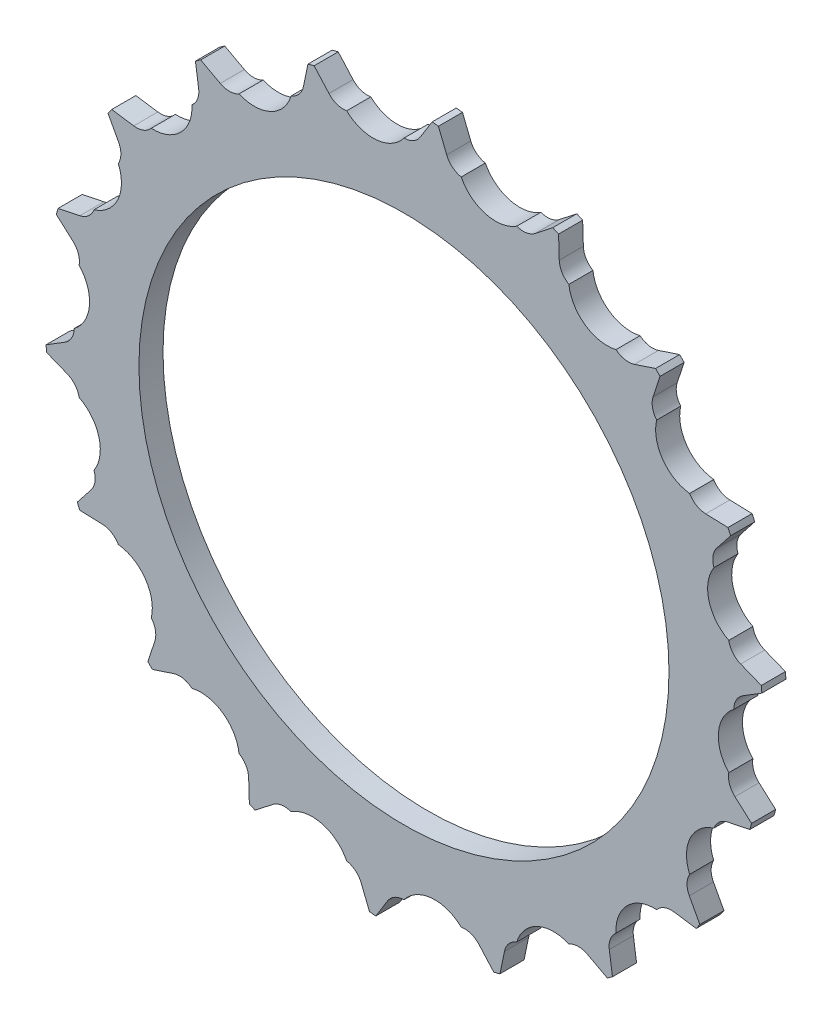
from build123d import *

# Parameters (mm, degrees)
BOSS_EXTRUDE1_DEPTH                 = 5
SKETCH2_R                           = 12.5
BOSS_EXTRUDE2_DEPTH                 = 40
CUT_EXTRUDE2_DEPTH                  = 10
SKETCH9_R                           = 100
SKETCH9_R_2                         = 74.5
CUT_EXTRUDE5_DEPTH                  = 10
FILLET1_R                           = 30
SKETCH3_R                           = 5
CUT_EXTRUDE1_DEPTH                  = 115.269213892
F_1_0MM_DOWEL_HOLE1_D               = 2.8
F_1_0MM_DOWEL_HOLE1_DEPTH           = 33.158795133
F_1_0MM_DOWEL_HOLE1_TIP             = 0.841204867
F_1_0MM_DOWEL_HOLE1_ON_FACE_2_D     = 2.8
F_1_0MM_DOWEL_HOLE1_ON_FACE_2_DEPTH = 33.158795133
F_1_0MM_DOWEL_HOLE1_ON_FACE_2_TIP   = 0.841204867
CIRPATTERN1_COUNT                   = 18
CUT_EXTRUDE3_DEPTH                  = 115.269213931
CUT_EXTRUDE3_DEPTH_BACK             = 115.269213931
SKETCH6_W                           = 154.176776301
SKETCH6_H                           = 44.757292759
CUT_EXTRUDE4_DEPTH                  = 106.288856217
CUT_EXTRUDE4_DEPTH_BACK             = 106.288856217
SKETCH10_R                          = 55
CUT_EXTRUDE6_DEPTH                  = 10


with BuildPart() as part:
    # Sketch1 → Boss-Extrude1 (new body)
    with BuildSketch(Plane.XY):
        with BuildLine():
            ThreePointArc((3.400646872, 70.34391338), (0, 68.45), (-3.400646872, 70.34391338))
            Line((-3.400646872, 70.34391338), (-6.085453124, 74.679004775))
            ThreePointArc((-6.085453124, 74.679004775), (-6.554111855, 74.913841296), (-6.974871672, 74.601190735))
            Line((-6.974871672, 74.601190735), (-8.866108963, 69.865747406))
            ThreePointArc((-8.866108963, 69.865747406), (-11.886217761, 67.410090694), (-15.564075773, 68.684715142))
            Line((-15.564075773, 68.684715142), (-18.960874506, 72.487735044))
            ThreePointArc((-18.960874506, 72.487735044), (-19.463192192, 72.637622137), (-19.823268522, 72.256657264))
            Line((-19.823268522, 72.256657264), (-20.863472565, 67.264746051))
            ThreePointArc((-20.863472565, 67.264746051), (-23.411278811, 64.321959893), (-27.254598108, 64.93856659))
            Line((-27.254598108, 64.93856659), (-31.260179312, 68.093962165))
            ThreePointArc((-31.260179312, 68.093962165), (-31.780893283, 68.154345585), (-32.069345388, 67.716641827))
            Line((-32.069345388, 67.716641827), (-32.226910109, 62.619939425))
            ThreePointArc((-32.226910109, 62.619939425), (-34.225, 59.279438889), (-38.117003271, 59.219292553))
            Line((-38.117003271, 59.219292553), (-42.609659387, 61.631188702))
            ThreePointArc((-42.609659387, 61.631188702), (-43.132948014, 61.600233731), (-43.341011423, 61.119090493))
            Line((-43.341011423, 61.119090493), (-42.611149298, 56.072457626))
            ThreePointArc((-42.611149298, 56.072457626), (-43.998811883, 52.435742131), (-47.821242577, 51.700670278))
            Line((-47.821242577, 51.700670278), (-52.664466523, 53.295782758))
            ThreePointArc((-52.664466523, 53.295782758), (-53.174429945, 53.174429945), (-53.295782758, 52.664466523))
            Line((-53.295782758, 52.664466523), (-51.700670278, 47.821242577))
            ThreePointArc((-51.700670278, 47.821242577), (-52.435742131, 43.998811883), (-56.072457626, 42.611149298))
            Line((-56.072457626, 42.611149298), (-61.119090493, 43.341011423))
            ThreePointArc((-61.119090493, 43.341011423), (-61.600233731, 43.132948014), (-61.631188702, 42.609659387))
            Line((-61.631188702, 42.609659387), (-59.219292553, 38.117003271))
            ThreePointArc((-59.219292553, 38.117003271), (-59.279438889, 34.225), (-62.619939425, 32.226910109))
            Line((-62.619939425, 32.226910109), (-67.716641827, 32.069345388))
            ThreePointArc((-67.716641827, 32.069345388), (-68.154345585, 31.780893283), (-68.093962165, 31.260179312))
            Line((-68.093962165, 31.260179312), (-64.93856659, 27.254598108))
            ThreePointArc((-64.93856659, 27.254598108), (-64.321959893, 23.411278811), (-67.264746051, 20.863472565))
            Line((-67.264746051, 20.863472565), (-72.256657264, 19.823268522))
            ThreePointArc((-72.256657264, 19.823268522), (-72.637622137, 19.463192192), (-72.487735044, 18.960874506))
            Line((-72.487735044, 18.960874506), (-68.684715142, 15.564075773))
            ThreePointArc((-68.684715142, 15.564075773), (-67.410090694, 11.886217761), (-69.865747406, 8.866108963))
            Line((-69.865747406, 8.866108963), (-74.601190735, 6.974871672))
            ThreePointArc((-74.601190735, 6.974871672), (-74.913841296, 6.554111855), (-74.679004775, 6.085453124))
            Line((-74.679004775, 6.085453124), (-70.34391338, 3.400646872))
            ThreePointArc((-70.34391338, 3.400646872), (-68.45, 0), (-70.34391338, -3.400646872))
            Line((-70.34391338, -3.400646872), (-74.679004775, -6.085453124))
            ThreePointArc((-74.679004775, -6.085453124), (-74.913841296, -6.554111855), (-74.601190735, -6.974871672))
            Line((-74.601190735, -6.974871672), (-69.865747406, -8.866108963))
            ThreePointArc((-69.865747406, -8.866108963), (-67.410090694, -11.886217761), (-68.684715142, -15.564075773))
            Line((-68.684715142, -15.564075773), (-72.487735044, -18.960874506))
            ThreePointArc((-72.487735044, -18.960874506), (-72.637622137, -19.463192192), (-72.256657264, -19.823268522))
            Line((-72.256657264, -19.823268522), (-67.264746051, -20.863472565))
            ThreePointArc((-67.264746051, -20.863472565), (-64.321959893, -23.411278811), (-64.93856659, -27.254598108))
            Line((-64.93856659, -27.254598108), (-68.093962165, -31.260179312))
            ThreePointArc((-68.093962165, -31.260179312), (-68.154345585, -31.780893283), (-67.716641827, -32.069345388))
            Line((-67.716641827, -32.069345388), (-62.619939425, -32.226910109))
            ThreePointArc((-62.619939425, -32.226910109), (-59.279438889, -34.225), (-59.219292553, -38.117003271))
            Line((-59.219292553, -38.117003271), (-61.631188702, -42.609659387))
            ThreePointArc((-61.631188702, -42.609659387), (-61.600233731, -43.132948014), (-61.119090493, -43.341011423))
            Line((-61.119090493, -43.341011423), (-56.072457626, -42.611149298))
            ThreePointArc((-56.072457626, -42.611149298), (-52.435742131, -43.998811883), (-51.700670278, -47.821242577))
            Line((-51.700670278, -47.821242577), (-53.295782758, -52.664466523))
            ThreePointArc((-53.295782758, -52.664466523), (-53.174429945, -53.174429945), (-52.664466523, -53.295782758))
            Line((-52.664466523, -53.295782758), (-47.821242577, -51.700670278))
            ThreePointArc((-47.821242577, -51.700670278), (-43.998811883, -52.435742131), (-42.611149298, -56.072457626))
            Line((-42.611149298, -56.072457626), (-43.341011423, -61.119090493))
            ThreePointArc((-43.341011423, -61.119090493), (-43.132948014, -61.600233731), (-42.609659387, -61.631188702))
            Line((-42.609659387, -61.631188702), (-38.117003271, -59.219292553))
            ThreePointArc((-38.117003271, -59.219292553), (-34.225, -59.279438889), (-32.226910109, -62.619939425))
            Line((-32.226910109, -62.619939425), (-32.069345388, -67.716641827))
            ThreePointArc((-32.069345388, -67.716641827), (-31.780893283, -68.154345585), (-31.260179312, -68.093962165))
            Line((-31.260179312, -68.093962165), (-27.254598108, -64.93856659))
            ThreePointArc((-27.254598108, -64.93856659), (-23.411278811, -64.321959893), (-20.863472565, -67.264746051))
            Line((-20.863472565, -67.264746051), (-19.823268522, -72.256657264))
            ThreePointArc((-19.823268522, -72.256657264), (-19.463192192, -72.637622137), (-18.960874506, -72.487735044))
            Line((-18.960874506, -72.487735044), (-15.564075773, -68.684715142))
            ThreePointArc((-15.564075773, -68.684715142), (-11.886217761, -67.410090694), (-8.866108963, -69.865747406))
            Line((-8.866108963, -69.865747406), (-6.974871672, -74.601190735))
            ThreePointArc((-6.974871672, -74.601190735), (-6.554111855, -74.913841296), (-6.085453124, -74.679004775))
            Line((-6.085453124, -74.679004775), (-3.400646872, -70.34391338))
            ThreePointArc((-3.400646872, -70.34391338), (0, -68.45), (3.400646872, -70.34391338))
            Line((3.400646872, -70.34391338), (6.085453124, -74.679004775))
            ThreePointArc((6.085453124, -74.679004775), (6.554111855, -74.913841296), (6.974871672, -74.601190735))
            Line((6.974871672, -74.601190735), (8.866108963, -69.865747406))
            ThreePointArc((8.866108963, -69.865747406), (11.886217761, -67.410090694), (15.564075773, -68.684715142))
            Line((15.564075773, -68.684715142), (18.960874506, -72.487735044))
            ThreePointArc((18.960874506, -72.487735044), (19.463192192, -72.637622137), (19.823268522, -72.256657264))
            Line((19.823268522, -72.256657264), (20.863472565, -67.264746051))
            ThreePointArc((20.863472565, -67.264746051), (23.411278811, -64.321959893), (27.254598108, -64.93856659))
            Line((27.254598108, -64.93856659), (31.260179312, -68.093962165))
            ThreePointArc((31.260179312, -68.093962165), (31.780893283, -68.154345585), (32.069345388, -67.716641827))
            Line((32.069345388, -67.716641827), (32.226910109, -62.619939425))
            ThreePointArc((32.226910109, -62.619939425), (34.225, -59.279438889), (38.117003271, -59.219292553))
            Line((38.117003271, -59.219292553), (42.609659387, -61.631188702))
            ThreePointArc((42.609659387, -61.631188702), (43.132948014, -61.600233731), (43.341011423, -61.119090493))
            Line((43.341011423, -61.119090493), (42.611149298, -56.072457626))
            ThreePointArc((42.611149298, -56.072457626), (43.998811883, -52.435742131), (47.821242577, -51.700670278))
            Line((47.821242577, -51.700670278), (52.664466523, -53.295782758))
            ThreePointArc((52.664466523, -53.295782758), (53.174429945, -53.174429945), (53.295782758, -52.664466523))
            Line((53.295782758, -52.664466523), (51.700670278, -47.821242577))
            ThreePointArc((51.700670278, -47.821242577), (52.435742131, -43.998811883), (56.072457626, -42.611149298))
            Line((56.072457626, -42.611149298), (61.119090493, -43.341011423))
            ThreePointArc((61.119090493, -43.341011423), (61.600233731, -43.132948014), (61.631188702, -42.609659387))
            Line((61.631188702, -42.609659387), (59.219292553, -38.117003271))
            ThreePointArc((59.219292553, -38.117003271), (59.279438889, -34.225), (62.619939425, -32.226910109))
            Line((62.619939425, -32.226910109), (67.716641827, -32.069345388))
            ThreePointArc((67.716641827, -32.069345388), (68.154345585, -31.780893283), (68.093962165, -31.260179312))
            Line((68.093962165, -31.260179312), (64.93856659, -27.254598108))
            ThreePointArc((64.93856659, -27.254598108), (64.321959893, -23.411278811), (67.264746051, -20.863472565))
            Line((67.264746051, -20.863472565), (72.256657264, -19.823268522))
            ThreePointArc((72.256657264, -19.823268522), (72.637622137, -19.463192192), (72.487735044, -18.960874506))
            Line((72.487735044, -18.960874506), (68.684715142, -15.564075773))
            ThreePointArc((68.684715142, -15.564075773), (67.410090694, -11.886217761), (69.865747406, -8.866108963))
            Line((69.865747406, -8.866108963), (74.601190735, -6.974871672))
            ThreePointArc((74.601190735, -6.974871672), (74.913841296, -6.554111855), (74.679004775, -6.085453124))
            Line((74.679004775, -6.085453124), (70.34391338, -3.400646872))
            ThreePointArc((70.34391338, -3.400646872), (68.45, 0), (70.34391338, 3.400646872))
            Line((70.34391338, 3.400646872), (74.679004775, 6.085453124))
            ThreePointArc((74.679004775, 6.085453124), (74.913841296, 6.554111855), (74.601190735, 6.974871672))
            Line((74.601190735, 6.974871672), (69.865747406, 8.866108963))
            ThreePointArc((69.865747406, 8.866108963), (67.410090694, 11.886217761), (68.684715142, 15.564075773))
            Line((68.684715142, 15.564075773), (72.487735044, 18.960874506))
            ThreePointArc((72.487735044, 18.960874506), (72.637622137, 19.463192192), (72.256657264, 19.823268522))
            Line((72.256657264, 19.823268522), (67.264746051, 20.863472565))
            ThreePointArc((67.264746051, 20.863472565), (64.321959893, 23.411278811), (64.93856659, 27.254598108))
            Line((64.93856659, 27.254598108), (68.093962165, 31.260179312))
            ThreePointArc((68.093962165, 31.260179312), (68.154345585, 31.780893283), (67.716641827, 32.069345388))
            Line((67.716641827, 32.069345388), (62.619939425, 32.226910109))
            ThreePointArc((62.619939425, 32.226910109), (59.279438889, 34.225), (59.219292553, 38.117003271))
            Line((59.219292553, 38.117003271), (61.631188702, 42.609659387))
            ThreePointArc((61.631188702, 42.609659387), (61.600233731, 43.132948014), (61.119090493, 43.341011423))
            Line((61.119090493, 43.341011423), (56.072457626, 42.611149298))
            ThreePointArc((56.072457626, 42.611149298), (52.435742131, 43.998811883), (51.700670278, 47.821242577))
            Line((51.700670278, 47.821242577), (53.295782758, 52.664466523))
            ThreePointArc((53.295782758, 52.664466523), (53.174429945, 53.174429945), (52.664466523, 53.295782758))
            Line((52.664466523, 53.295782758), (47.821242577, 51.700670278))
            ThreePointArc((47.821242577, 51.700670278), (43.998811883, 52.435742131), (42.611149298, 56.072457626))
            Line((42.611149298, 56.072457626), (43.341011423, 61.119090493))
            ThreePointArc((43.341011423, 61.119090493), (43.132948014, 61.600233731), (42.609659387, 61.631188702))
            Line((42.609659387, 61.631188702), (38.117003271, 59.219292553))
            ThreePointArc((38.117003271, 59.219292553), (34.225, 59.279438889), (32.226910109, 62.619939425))
            Line((32.226910109, 62.619939425), (32.069345388, 67.716641827))
            ThreePointArc((32.069345388, 67.716641827), (31.780893283, 68.154345585), (31.260179312, 68.093962165))
            Line((31.260179312, 68.093962165), (27.254598108, 64.93856659))
            ThreePointArc((27.254598108, 64.93856659), (23.411278811, 64.321959893), (20.863472565, 67.264746051))
            Line((20.863472565, 67.264746051), (19.823268522, 72.256657264))
            ThreePointArc((19.823268522, 72.256657264), (19.463192192, 72.637622137), (18.960874506, 72.487735044))
            Line((18.960874506, 72.487735044), (15.564075773, 68.684715142))
            ThreePointArc((15.564075773, 68.684715142), (11.886217761, 67.410090694), (8.866108963, 69.865747406))
            Line((8.866108963, 69.865747406), (6.974871672, 74.601190735))
            ThreePointArc((6.974871672, 74.601190735), (6.554111855, 74.913841296), (6.085453124, 74.679004775))
            Line((6.085453124, 74.679004775), (3.400646872, 70.34391338))
        make_face()
    extrude(amount=BOSS_EXTRUDE1_DEPTH)

    # Sketch2 → Boss-Extrude2 (add)
    with BuildSketch(Plane.XY.offset(5)):
        Circle(SKETCH2_R)
    extrude(amount=BOSS_EXTRUDE2_DEPTH)

    # Sketch5 → Cut-Extrude2 (cut)
    with BuildSketch(Plane(origin=(0, 0, 0), x_dir=(-1, 0, 0), z_dir=(0, 0, -1))):
        with BuildLine():
            Line((0, 68.45), (0.611002974, 75.43379595))
            Line((0.611002974, 75.43379595), (12.497220735, 74.393886643))
            Line((12.497220735, 74.393886643), (11.886217761, 67.410090694))
            ThreePointArc((11.886217761, 67.410090694), (5.710404715, 65.270224566), (0, 68.45))
        make_face()
    cut_extrude2 = extrude(amount=-CUT_EXTRUDE2_DEPTH, mode=Mode.SUBTRACT)

    # Sketch9 → Cut-Extrude5 (cut)
    with BuildSketch(Plane(origin=(0, 0, 0), x_dir=(-1, 0, 0), z_dir=(0, 0, -1))):
        Circle(SKETCH9_R)
        Circle(SKETCH9_R_2, mode=Mode.SUBTRACT)
    extrude(amount=-CUT_EXTRUDE5_DEPTH, mode=Mode.SUBTRACT)

    # Fillet1
    fillet1_edges = [part.edges().sort_by_distance(p)[0] for p in [
        (-12.5, 0, 5),
    ]]
    fillet(fillet1_edges, radius=FILLET1_R)

    # Sketch3 → Cut-Extrude1 (cut, through all)
    with BuildSketch(Plane.XY.offset(45)):
        Circle(SKETCH3_R)
    extrude(amount=-CUT_EXTRUDE1_DEPTH, mode=Mode.SUBTRACT)

    # Ø1.0mm Dowel Hole1
    with Locations(Plane(origin=(-6.81763654, -10.477109907, 42.020116055), x_dir=(-0.838168792578, 0.545410923202, 0), z_dir=(-0.545410923202, -0.838168792578, 0))):
        with Locations((0, 0)):
            Hole(F_1_0MM_DOWEL_HOLE1_D / 2, depth=F_1_0MM_DOWEL_HOLE1_DEPTH)
            with Locations((0, 0, -(F_1_0MM_DOWEL_HOLE1_DEPTH + F_1_0MM_DOWEL_HOLE1_TIP / 2))):  # 118° drill point
                Cone(0, F_1_0MM_DOWEL_HOLE1_D / 2, F_1_0MM_DOWEL_HOLE1_TIP, mode=Mode.SUBTRACT)

    # Ø1.0mm Dowel Hole1 on face 2
    with Locations(Plane(origin=(-11.068439798, 5.808583342, 41.658255729), x_dir=(-0.464687003812, -0.885475007264, 0), z_dir=(-0.885475007264, 0.464687003812, 0))):
        with Locations((0, 0)):
            Hole(F_1_0MM_DOWEL_HOLE1_ON_FACE_2_D / 2, depth=F_1_0MM_DOWEL_HOLE1_ON_FACE_2_DEPTH)
            with Locations((0, 0, -(F_1_0MM_DOWEL_HOLE1_ON_FACE_2_DEPTH + F_1_0MM_DOWEL_HOLE1_ON_FACE_2_TIP / 2))):  # 118° drill point
                Cone(0, F_1_0MM_DOWEL_HOLE1_ON_FACE_2_D / 2, F_1_0MM_DOWEL_HOLE1_ON_FACE_2_TIP, mode=Mode.SUBTRACT)

    # CirPattern1: Cut-Extrude2 ×18 about axis
    cirpattern1_axis = Axis((0, 0, 0), (0, 0, 1))
    for i in range(1, CIRPATTERN1_COUNT):
        add(cut_extrude2.rotate(cirpattern1_axis, i * 360 / CIRPATTERN1_COUNT), mode=Mode.SUBTRACT)

    # Sketch6 → Cut-Extrude3 (cut, two sides: drawn at the far end of the back side and taken through both)
    with BuildSketch(Plane(origin=(0, 0, 0), x_dir=(1, 0, 0), z_dir=(0, 1, 0)).offset(-CUT_EXTRUDE3_DEPTH_BACK)):
        with Locations((2.817083989, -29.67864638)):
            Rectangle(SKETCH6_W, SKETCH6_H)
    extrude(amount=CUT_EXTRUDE3_DEPTH + CUT_EXTRUDE3_DEPTH_BACK, mode=Mode.SUBTRACT)

    # Sketch7 → Cut-Extrude4 (cut, two sides: drawn at the far end of the back side and taken through both)
    with BuildSketch(Plane(origin=(0, 0, 0), x_dir=(-1, 0, 0), z_dir=(0, 0, -1)).offset(-CUT_EXTRUDE4_DEPTH_BACK)):
        Polygon((12.6, -7.274613392), (12.6, 7.274613392), (0, 14.549226784), (-12.6, 7.274613392), (-12.6, -7.274613392), (0, -14.549226784), align=None)
    extrude(amount=CUT_EXTRUDE4_DEPTH + CUT_EXTRUDE4_DEPTH_BACK, mode=Mode.SUBTRACT)

    # Sketch10 → Cut-Extrude6 (cut)
    with BuildSketch(Plane(origin=(0, 0, 0), x_dir=(-1, 0, 0), z_dir=(0, 0, -1))):
        Circle(SKETCH10_R)
    extrude(amount=-CUT_EXTRUDE6_DEPTH, mode=Mode.SUBTRACT)


solid = part.part
